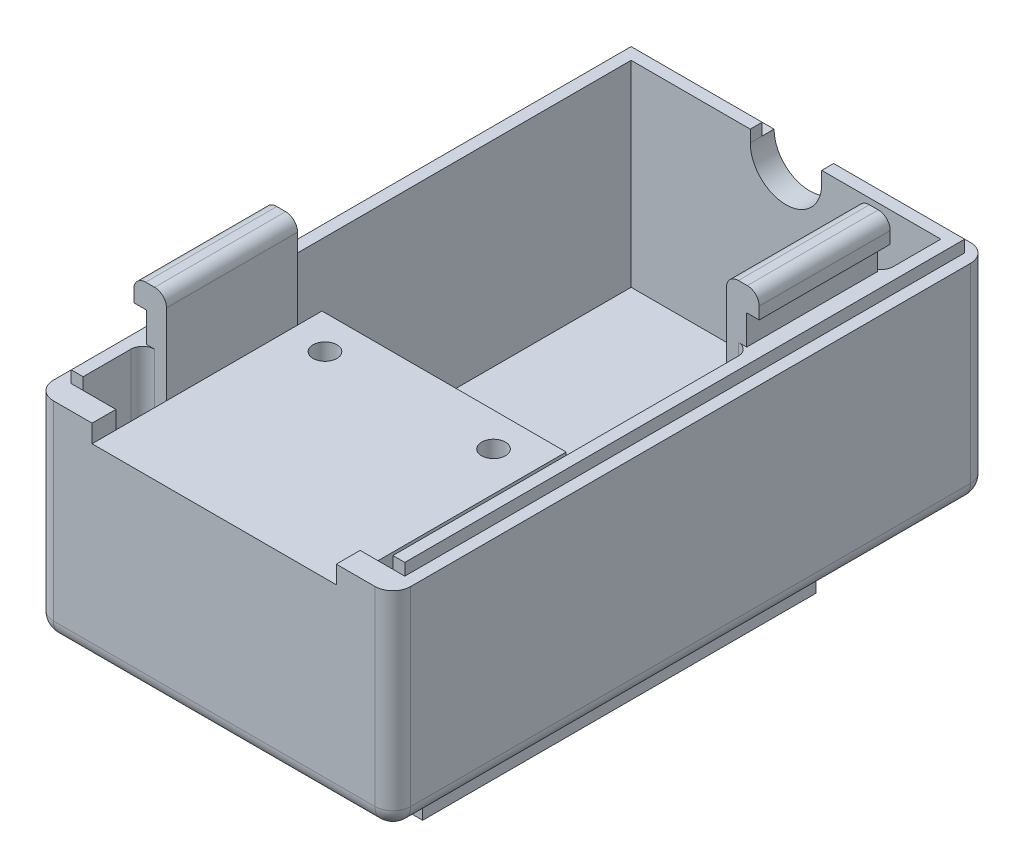
from build123d import *

# Parameters (mm, degrees)
BOSS_EXTRUDE1_DEPTH  = 17.5
CUT_EXTRUDE1_DEPTH   = 15.5
SKETCH3_W            = 20.5
SKETCH3_H            = 1.5
CUT_EXTRUDE2_DEPTH   = 15.5
SKETCH5_W            = 20.5
SKETCH5_H            = 17.3
BOSS_EXTRUDE2_DEPTH  = 14
CUT_EXTRUDE4_START   = 8
SKETCH5_3_R          = 1
CUT_EXTRUDE4_DEPTH   = 6
FILLET3_R            = 1.5
SKETCH7_W            = 11
SKETCH7_H            = 5.5
BOSS_EXTRUDE7_DEPTH  = 2
SKETCH8_W            = 11
SKETCH8_H            = 2
BOSS_EXTRUDE8_DEPTH  = 0.75
SKETCH8_3_W          = 11
SKETCH8_3_H          = 2.5
CUT_EXTRUDE5_DEPTH   = 0.3
CUT_EXTRUDE7_REACH   = 59.044
SKETCH9_W            = 11
SKETCH9_H            = 5.5
BOSS_EXTRUDE12_DEPTH = 2
SKETCH10_W           = 11
SKETCH10_H           = 2
BOSS_EXTRUDE13_DEPTH = 0.75
SKETCH10_3_W         = 11
SKETCH10_3_H         = 2.5
CUT_EXTRUDE6_DEPTH   = 0.3
BOSS_EXTRUDE14_DEPTH = 1
FILLET4_R            = 1
SKETCH13_W           = 18
SKETCH13_H           = 33
BOSS_EXTRUDE15_DEPTH = 6
FILLET5_R            = 1
FILLET6_R            = 2
FILLET7_R            = 1


with BuildPart() as part:
    # Sketch1 → Boss-Extrude1 (new body)
    with BuildSketch(Plane(origin=(0, 0, 0), x_dir=(1, 0, 0), z_dir=(0, 1, 0))):
        Polygon((-15, 20), (-15, -20), (15, -20), (15, 20), (15, 30), (-15, 30), align=None)
    extrude(amount=BOSS_EXTRUDE1_DEPTH)

    # Sketch2 → Cut-Extrude1 (cut)
    with BuildSketch(Plane(origin=(0, 17.5, 0), x_dir=(1, 0, 0), z_dir=(0, 1, 0))):
        Polygon((-13, 18), (-13, -18), (13, -18), (13, 18), (13, 28), (-13, 28), align=None)
    extrude(amount=-CUT_EXTRUDE1_DEPTH, mode=Mode.SUBTRACT)

    # Sketch3 → Cut-Extrude2 (cut)
    with BuildSketch(Plane.XY.offset(20)):
        with Locations((0, 16.75)):
            Rectangle(SKETCH3_W, SKETCH3_H)
    extrude(amount=-CUT_EXTRUDE2_DEPTH, mode=Mode.SUBTRACT)

    # Sketch5 → Boss-Extrude2 (add)
    with BuildSketch(Plane(origin=(0, 2, 0), x_dir=(1, 0, 0), z_dir=(0, 1, 0))):
        with Locations((0, -9.35)):
            Rectangle(SKETCH5_W, SKETCH5_H)
    extrude(amount=BOSS_EXTRUDE2_DEPTH)

    # Sketch5<3> → Cut-Extrude4 (cut)
    with BuildSketch(Plane(origin=(0, 2, 0), x_dir=(1, 0, 0), z_dir=(0, 1, 0)).offset(CUT_EXTRUDE4_START)):
        with Locations(Location((6.975, -3.5255, 0), (0, 0, 90))):
            Circle(SKETCH5_3_R)
        with Locations(Location((-7.175, -3.5255, 0), (0, 0, 270))):
            Circle(SKETCH5_3_R)
    extrude(amount=CUT_EXTRUDE4_DEPTH, mode=Mode.SUBTRACT)

    # Fillet3
    fillet3_edges = [part.edges().sort_by_distance(p)[0] for p in [
        (15, 8.75, 20),
        (-15, 8.75, 20),
        (-15, 8.75, -30),
        (15, 8.75, -30),
        (0, 0, 20),
        (-15, 0, -5),
        (0, 0, -30),
        (15, 0, -5),
    ]]
    fillet(fillet3_edges, radius=FILLET3_R)

    # Sketch7 → Boss-Extrude7 (add)
    with BuildSketch(Plane(origin=(-13, 0, 0), x_dir=(0, 0, -1), z_dir=(1, 0, 0))):
        with Locations((-7.5, 14.75)):
            Rectangle(SKETCH7_W, SKETCH7_H)
        with Locations((-7.5, 20.25)):
            Rectangle(SKETCH7_W, SKETCH7_H)
    extrude(amount=BOSS_EXTRUDE7_DEPTH)

    # Sketch8 → Boss-Extrude8 (add)
    with BuildSketch(Plane.ZY.offset(13)):
        with Locations((7.5, 22)):
            Rectangle(SKETCH8_W, SKETCH8_H)
    extrude(amount=BOSS_EXTRUDE8_DEPTH)

    # Sketch8<3> → Cut-Extrude5 (cut)
    with BuildSketch(Plane.ZY.offset(13)):
        with Locations((7.5, 19.75)):
            Rectangle(SKETCH8_3_W, SKETCH8_3_H)
    extrude(amount=-CUT_EXTRUDE5_DEPTH, mode=Mode.SUBTRACT)

    # Sketch12 → Cut-Extrude7 (cut, up to next)
    with BuildSketch(Plane(origin=(0, 0, -30), x_dir=(-1, 0, 0), z_dir=(0, 0, -1)), mode=Mode.PRIVATE) as cut_extrude7_sk1:
        with BuildLine():
            Line((-3, 17.5), (3, 17.5))
            ThreePointArc((3, 17.5), (0, 14.5), (-3, 17.5))
        make_face()
    cut_extrude7_tool1 = extrude(cut_extrude7_sk1.sketch, amount=-CUT_EXTRUDE7_REACH, mode=Mode.PRIVATE) & part.part
    add(cut_extrude7_tool1.solids().sort_by_distance((0, 16.22676, -30))[0], mode=Mode.SUBTRACT)

    # Sketch9 → Boss-Extrude12 (add)
    with BuildSketch(Plane.ZY.offset(-13)):
        with Locations((-17.5, 14.75)):
            Rectangle(SKETCH9_W, SKETCH9_H)
        with Locations((-17.5, 20.25)):
            Rectangle(SKETCH9_W, SKETCH9_H)
    extrude(amount=BOSS_EXTRUDE12_DEPTH)

    # Sketch10 → Boss-Extrude13 (add)
    with BuildSketch(Plane(origin=(13, 0, 0), x_dir=(0, 0, -1), z_dir=(1, 0, 0))):
        with Locations((17.5, 22)):
            Rectangle(SKETCH10_W, SKETCH10_H)
    extrude(amount=BOSS_EXTRUDE13_DEPTH)

    # Sketch10<3> → Cut-Extrude6 (cut)
    with BuildSketch(Plane(origin=(13, 0, 0), x_dir=(0, 0, -1), z_dir=(1, 0, 0))):
        with Locations((17.5, 19.75)):
            Rectangle(SKETCH10_3_W, SKETCH10_3_H)
    extrude(amount=-CUT_EXTRUDE6_DEPTH, mode=Mode.SUBTRACT)

    # Sketch11 → Boss-Extrude14 (add)
    with BuildSketch(Plane(origin=(0, 17.5, 0), x_dir=(1, 0, 0), z_dir=(0, 1, 0))):
        Polygon((-14, -18), (-13, -18), (-13, 28), (-3, 28), (-3, 29), (-14, 29), align=None)
        Polygon((3, 28), (13, 28), (13, -18), (14, -18), (14, 29), (3, 29), align=None)
    extrude(amount=BOSS_EXTRUDE14_DEPTH)

    # Fillet4
    # the kernel refuses this fillet: 1 mm, written as the material it adds along each edge
    with BuildSketch(Plane(origin=(-13, 12, 13), x_dir=(1, 0, 0), z_dir=(0, 1, 0)), Plane(origin=(-13, 18.5, 2), x_dir=(1, 0, 0), z_dir=(0, -1, 0))) as fillet4_piece_1:
        with BuildLine():
            CenterArc((FILLET4_R, -FILLET4_R), FILLET4_R, 90, 90)
            Line((0, -FILLET4_R), (-FILLET4_R * 0.02, -FILLET4_R))
            Line((-FILLET4_R * 0.02, -FILLET4_R), (-FILLET4_R * 0.02, FILLET4_R * 0.02))
            Line((-FILLET4_R * 0.02, FILLET4_R * 0.02), (FILLET4_R, FILLET4_R * 0.02))
            Line((FILLET4_R, FILLET4_R * 0.02), (FILLET4_R, 0))
        make_face()
    extrude(amount=6.5)
    with BuildSketch(Plane(origin=(-13, 12, 13), x_dir=(1, 0, 0), z_dir=(0, 0, -1))) as fillet4_piece_2:
        with BuildLine():
            CenterArc((FILLET4_R, FILLET4_R), FILLET4_R, 180, 90)
            Line((0, FILLET4_R), (-FILLET4_R * 0.02, FILLET4_R))
            Line((-FILLET4_R * 0.02, FILLET4_R), (-FILLET4_R * 0.02, -FILLET4_R * 0.02))
            Line((-FILLET4_R * 0.02, -FILLET4_R * 0.02), (FILLET4_R, -FILLET4_R * 0.02))
            Line((FILLET4_R, -FILLET4_R * 0.02), (FILLET4_R, 0))
        make_face()
    extrude(amount=11)
    with BuildSketch(Plane(origin=(13, 12, -23), x_dir=(0, 0, -1), z_dir=(0, 1, 0)), Plane(origin=(13, 18.5, -12), x_dir=(0, 0, 1), z_dir=(0, -1, 0))) as fillet4_piece_3:
        with BuildLine():
            CenterArc((FILLET4_R, FILLET4_R), FILLET4_R, 180, 90)
            Line((0, FILLET4_R), (-FILLET4_R * 0.02, FILLET4_R))
            Line((-FILLET4_R * 0.02, FILLET4_R), (-FILLET4_R * 0.02, -FILLET4_R * 0.02))
            Line((-FILLET4_R * 0.02, -FILLET4_R * 0.02), (FILLET4_R, -FILLET4_R * 0.02))
            Line((FILLET4_R, -FILLET4_R * 0.02), (FILLET4_R, 0))
        make_face()
    extrude(amount=6.5)
    with BuildSketch(Plane(origin=(13, 12, -23), x_dir=(0, -1, 0), z_dir=(0, 0, 1))) as fillet4_piece_4:
        with BuildLine():
            CenterArc((FILLET4_R, -FILLET4_R), FILLET4_R, 90, 90)
            Line((0, -FILLET4_R), (-FILLET4_R * 0.02, -FILLET4_R))
            Line((-FILLET4_R * 0.02, -FILLET4_R), (-FILLET4_R * 0.02, FILLET4_R * 0.02))
            Line((-FILLET4_R * 0.02, FILLET4_R * 0.02), (FILLET4_R, FILLET4_R * 0.02))
            Line((FILLET4_R, FILLET4_R * 0.02), (FILLET4_R, 0))
        make_face()
    extrude(amount=11)
    with BuildSketch(Plane(origin=(-13, 12, 15.5), x_dir=(1, 0, 0), z_dir=(0, 0, -1))) as fillet4_piece_5a_section:
        with BuildLine():
            CenterArc((FILLET4_R, FILLET4_R), FILLET4_R, 180, 90)
            Line((0, FILLET4_R), (-FILLET4_R * 0.02, FILLET4_R))
            Line((-FILLET4_R * 0.02, FILLET4_R), (-FILLET4_R * 0.02, -FILLET4_R * 0.02))
            Line((-FILLET4_R * 0.02, -FILLET4_R * 0.02), (FILLET4_R, -FILLET4_R * 0.02))
            Line((FILLET4_R, -FILLET4_R * 0.02), (FILLET4_R, 0))
        make_face()
    fillet4_piece_5a = extrude(amount=13.5, mode=Mode.PRIVATE)
    fillet4_piece_5a = split(fillet4_piece_5a, bisect_by=Plane(origin=(-12.773604886, 11.773604886, 13), z_dir=(0, 0, 1)), keep=Keep.TOP, mode=Mode.PRIVATE)
    with BuildSketch(Plane(origin=(-13, 9.5, 13), x_dir=(1, 0, 0), z_dir=(0, 1, 0))) as fillet4_piece_5b_section:
        with BuildLine():
            CenterArc((FILLET4_R, -FILLET4_R), FILLET4_R, 90, 90)
            Line((0, -FILLET4_R), (-FILLET4_R * 0.02, -FILLET4_R))
            Line((-FILLET4_R * 0.02, -FILLET4_R), (-FILLET4_R * 0.02, FILLET4_R * 0.02))
            Line((-FILLET4_R * 0.02, FILLET4_R * 0.02), (FILLET4_R, FILLET4_R * 0.02))
            Line((FILLET4_R, FILLET4_R * 0.02), (FILLET4_R, 0))
        make_face()
    fillet4_piece_5b = extrude(amount=9, mode=Mode.PRIVATE)
    fillet4_piece_5b = split(fillet4_piece_5b, bisect_by=Plane(origin=(-12.773604886, 12, 13.226395114), z_dir=(0, -1, 0)), keep=Keep.TOP, mode=Mode.PRIVATE)
    fillet4_piece_5 = fillet4_piece_5a & fillet4_piece_5b
    add(fillet4_piece_5)
    with BuildSketch(Plane(origin=(-13, 18.5, 2), x_dir=(1, 0, 0), z_dir=(0, -1, 0))) as fillet4_piece_6a_section:
        with BuildLine():
            CenterArc((FILLET4_R, -FILLET4_R), FILLET4_R, 90, 90)
            Line((0, -FILLET4_R), (-FILLET4_R * 0.02, -FILLET4_R))
            Line((-FILLET4_R * 0.02, -FILLET4_R), (-FILLET4_R * 0.02, FILLET4_R * 0.02))
            Line((-FILLET4_R * 0.02, FILLET4_R * 0.02), (FILLET4_R, FILLET4_R * 0.02))
            Line((FILLET4_R, FILLET4_R * 0.02), (FILLET4_R, 0))
        make_face()
    fillet4_piece_6a = extrude(amount=9, mode=Mode.PRIVATE)
    fillet4_piece_6a = split(fillet4_piece_6a, bisect_by=Plane(origin=(-12.773604886, 12, 1.773604886), z_dir=(0, -1, 0)), keep=Keep.TOP, mode=Mode.PRIVATE)
    with BuildSketch(Plane(origin=(-13, 12, 13), x_dir=(1, 0, 0), z_dir=(0, 0, -1))) as fillet4_piece_6b_section:
        with BuildLine():
            CenterArc((FILLET4_R, FILLET4_R), FILLET4_R, 180, 90)
            Line((0, FILLET4_R), (-FILLET4_R * 0.02, FILLET4_R))
            Line((-FILLET4_R * 0.02, FILLET4_R), (-FILLET4_R * 0.02, -FILLET4_R * 0.02))
            Line((-FILLET4_R * 0.02, -FILLET4_R * 0.02), (FILLET4_R, -FILLET4_R * 0.02))
            Line((FILLET4_R, -FILLET4_R * 0.02), (FILLET4_R, 0))
        make_face()
    fillet4_piece_6b = extrude(amount=13.5, mode=Mode.PRIVATE)
    fillet4_piece_6b = split(fillet4_piece_6b, bisect_by=Plane(origin=(-12.773604886, 11.773604886, 2), z_dir=(0, 0, -1)), keep=Keep.TOP, mode=Mode.PRIVATE)
    fillet4_piece_6 = fillet4_piece_6a & fillet4_piece_6b
    add(fillet4_piece_6)
    with BuildSketch(Plane(origin=(13, 9.5, -23), x_dir=(0, 0, -1), z_dir=(0, 1, 0))) as fillet4_piece_7a_section:
        with BuildLine():
            CenterArc((FILLET4_R, FILLET4_R), FILLET4_R, 180, 90)
            Line((0, FILLET4_R), (-FILLET4_R * 0.02, FILLET4_R))
            Line((-FILLET4_R * 0.02, FILLET4_R), (-FILLET4_R * 0.02, -FILLET4_R * 0.02))
            Line((-FILLET4_R * 0.02, -FILLET4_R * 0.02), (FILLET4_R, -FILLET4_R * 0.02))
            Line((FILLET4_R, -FILLET4_R * 0.02), (FILLET4_R, 0))
        make_face()
    fillet4_piece_7a = extrude(amount=9, mode=Mode.PRIVATE)
    fillet4_piece_7a = split(fillet4_piece_7a, bisect_by=Plane(origin=(12.773604886, 12, -23.226395114), z_dir=(0, -1, 0)), keep=Keep.TOP, mode=Mode.PRIVATE)
    with BuildSketch(Plane(origin=(13, 12, -25.5), x_dir=(0, -1, 0), z_dir=(0, 0, 1))) as fillet4_piece_7b_section:
        with BuildLine():
            CenterArc((FILLET4_R, -FILLET4_R), FILLET4_R, 90, 90)
            Line((0, -FILLET4_R), (-FILLET4_R * 0.02, -FILLET4_R))
            Line((-FILLET4_R * 0.02, -FILLET4_R), (-FILLET4_R * 0.02, FILLET4_R * 0.02))
            Line((-FILLET4_R * 0.02, FILLET4_R * 0.02), (FILLET4_R, FILLET4_R * 0.02))
            Line((FILLET4_R, FILLET4_R * 0.02), (FILLET4_R, 0))
        make_face()
    fillet4_piece_7b = extrude(amount=13.5, mode=Mode.PRIVATE)
    fillet4_piece_7b = split(fillet4_piece_7b, bisect_by=Plane(origin=(12.773604886, 11.773604886, -23), z_dir=(0, 0, -1)), keep=Keep.TOP, mode=Mode.PRIVATE)
    fillet4_piece_7 = fillet4_piece_7a & fillet4_piece_7b
    add(fillet4_piece_7)
    with BuildSketch(Plane(origin=(13, 18.5, -12), x_dir=(0, 0, 1), z_dir=(0, -1, 0))) as fillet4_piece_8a_section:
        with BuildLine():
            CenterArc((FILLET4_R, FILLET4_R), FILLET4_R, 180, 90)
            Line((0, FILLET4_R), (-FILLET4_R * 0.02, FILLET4_R))
            Line((-FILLET4_R * 0.02, FILLET4_R), (-FILLET4_R * 0.02, -FILLET4_R * 0.02))
            Line((-FILLET4_R * 0.02, -FILLET4_R * 0.02), (FILLET4_R, -FILLET4_R * 0.02))
            Line((FILLET4_R, -FILLET4_R * 0.02), (FILLET4_R, 0))
        make_face()
    fillet4_piece_8a = extrude(amount=9, mode=Mode.PRIVATE)
    fillet4_piece_8a = split(fillet4_piece_8a, bisect_by=Plane(origin=(12.773604886, 12, -11.773604886), z_dir=(0, -1, 0)), keep=Keep.TOP, mode=Mode.PRIVATE)
    with BuildSketch(Plane(origin=(13, 12, -23), x_dir=(0, -1, 0), z_dir=(0, 0, 1))) as fillet4_piece_8b_section:
        with BuildLine():
            CenterArc((FILLET4_R, -FILLET4_R), FILLET4_R, 90, 90)
            Line((0, -FILLET4_R), (-FILLET4_R * 0.02, -FILLET4_R))
            Line((-FILLET4_R * 0.02, -FILLET4_R), (-FILLET4_R * 0.02, FILLET4_R * 0.02))
            Line((-FILLET4_R * 0.02, FILLET4_R * 0.02), (FILLET4_R, FILLET4_R * 0.02))
            Line((FILLET4_R, FILLET4_R * 0.02), (FILLET4_R, 0))
        make_face()
    fillet4_piece_8b = extrude(amount=13.5, mode=Mode.PRIVATE)
    fillet4_piece_8b = split(fillet4_piece_8b, bisect_by=Plane(origin=(12.773604886, 11.773604886, -12), z_dir=(0, 0, 1)), keep=Keep.TOP, mode=Mode.PRIVATE)
    fillet4_piece_8 = fillet4_piece_8a & fillet4_piece_8b
    add(fillet4_piece_8)
    # the kernel refuses this fillet: 1 mm, written as the material it takes off along each edge
    with BuildSketch(Plane(origin=(-11, 23, 2), x_dir=(0, -1, 0), z_dir=(0, 0, 1)), Plane(origin=(13.75, 23, -23), x_dir=(0, -1, 0), z_dir=(0, 0, 1))) as fillet4_2_piece_1:
        with BuildLine():
            CenterArc((FILLET4_R, -FILLET4_R), FILLET4_R, 90, 90)
            Line((0, -FILLET4_R), (-FILLET4_R * 0.02, -FILLET4_R))
            Line((-FILLET4_R * 0.02, -FILLET4_R), (-FILLET4_R * 0.02, FILLET4_R * 0.02))
            Line((-FILLET4_R * 0.02, FILLET4_R * 0.02), (FILLET4_R, FILLET4_R * 0.02))
            Line((FILLET4_R, FILLET4_R * 0.02), (FILLET4_R, 0))
        make_face()
    extrude(amount=11, mode=Mode.SUBTRACT)
    with BuildSketch(Plane(origin=(-13.75, 23, 13), x_dir=(1, 0, 0), z_dir=(0, 0, -1)), Plane(origin=(11, 23, -12), x_dir=(1, 0, 0), z_dir=(0, 0, -1))) as fillet4_2_piece_2:
        with BuildLine():
            CenterArc((FILLET4_R, FILLET4_R), FILLET4_R, 180, 90)
            Line((0, FILLET4_R), (-FILLET4_R * 0.02, FILLET4_R))
            Line((-FILLET4_R * 0.02, FILLET4_R), (-FILLET4_R * 0.02, -FILLET4_R * 0.02))
            Line((-FILLET4_R * 0.02, -FILLET4_R * 0.02), (FILLET4_R, -FILLET4_R * 0.02))
            Line((FILLET4_R, -FILLET4_R * 0.02), (FILLET4_R, 0))
        make_face()
    extrude(amount=11, mode=Mode.SUBTRACT)

    # Sketch13 → Boss-Extrude15 (add)
    with BuildSketch(Plane.XZ):
        with Locations((0, -5)):
            Rectangle(SKETCH13_W, SKETCH13_H)
        Polygon((0, -19.5), (-7, -19.5), (-7, -13.5), (-4.2, -13.5), (-4.2, -12.5), (-7, -12.5), (-7, -5.5), (0, -5.5), (0, -8.3), (1, -8.3), (1, -5.5), (7, -5.5), (7, -12.5), (5.2, -12.5), (5.2, -13.5), (7, -13.5), (7, -19.5), (1, -19.5), (1, -17.7), (0, -17.7), align=None, mode=Mode.SUBTRACT)
        Polygon((-7, 3.5), (-7, 9.5), (0, 9.5), (0, 7.7), (1, 7.7), (1, 9.5), (7, 9.5), (7, 3.5), (5.2, 3.5), (5.2, 2.5), (7, 2.5), (7, -4.5), (1, -4.5), (1, -1.7), (0, -1.7), (0, -4.5), (-7, -4.5), (-7, 2.5), (-4.2, 2.5), (-4.2, 3.5), align=None, mode=Mode.SUBTRACT)
    extrude(amount=BOSS_EXTRUDE15_DEPTH)

    # Fillet5
    fillet5_edges = [part.edges().sort_by_distance(p)[0] for p in [
        (5.2, -6, 3),
        (0.5, -6, -1.7),
        (-4.2, -6, 3),
        (0.5, -6, -17.7),
        (0.5, -6, -8.3),
        (5.2, -6, -13),
        (-4.2, -6, -13),
        (0.5, -6, 7.7),
    ]]
    fillet(fillet5_edges, radius=FILLET5_R)

    # Fillet6
    fillet6_edges = [part.edges().sort_by_distance(p)[0] for p in [
        (-9, 0, -5),
        (0, 0, -21.5),
        (9, 0, -5),
        (0, 0, 11.5),
    ]]
    fillet(fillet6_edges, radius=FILLET6_R)

    # Fillet7
    fillet7_edges = [part.edges().sort_by_distance(p)[0] for p in [
        (10.25, 2, 9.35),
        (-10.25, 2, 9.35),
        (0, 2, 0.7),
    ]]
    fillet(fillet7_edges, radius=FILLET7_R)


solid = part.part
